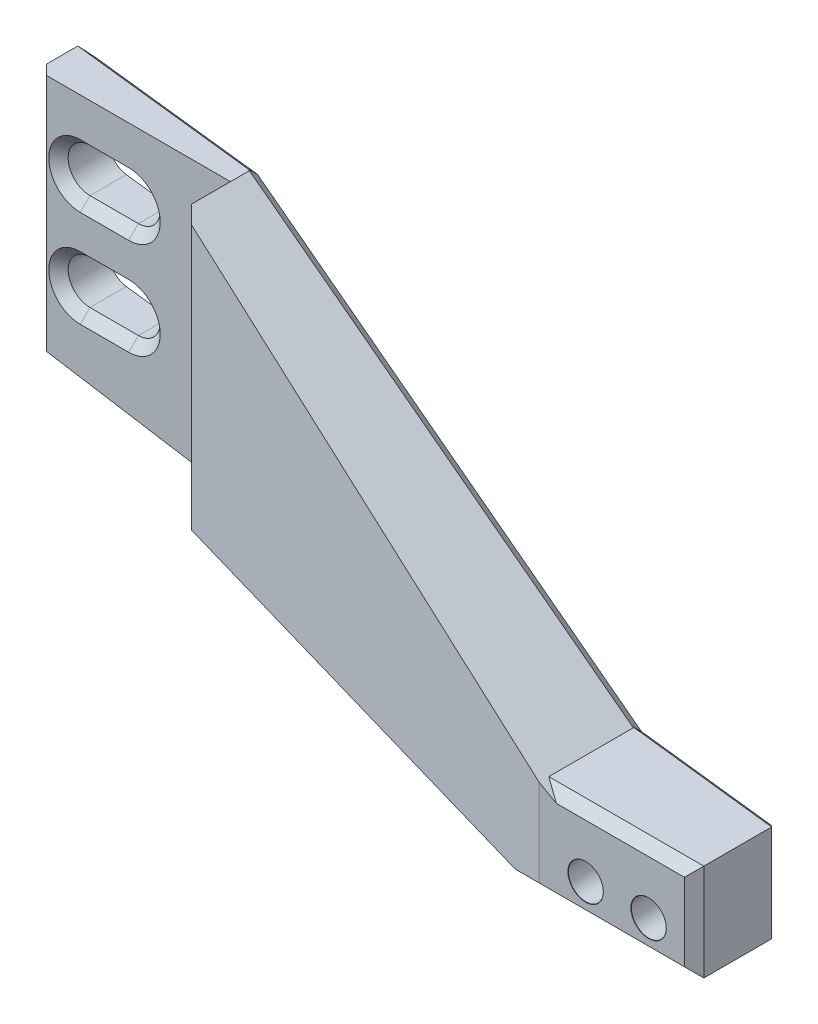
from build123d import *

# Parameters (mm, degrees)
BOSS_EXTRUDE1_DEPTH            = 18
CUT_EXTRUDE1_DEPTH             = 90.695930788
CHAMFER1_SIZE                  = 1
CHAMFER1_SIZE_2                = 1.13269448
CHAMFER1_SIZE_3                = 1.059024281
CHAMFER1_SIZE_4                = 0.982660718
CHAMFER1_SIZE_5                = 0.90514425
CHAMFER1_SIZE_6                = 1.228376825
M3_CLEARANCE_HOLE1_D           = 3.6
M3_CLEARANCE_HOLE1_DEPTH       = 4.418450886
M3_CLEARANCE_HOLE1_CSINK_D     = 3.65
M3_CLEARANCE_HOLE1_CSINK_ANGLE = 90
M3_CLEARANCE_HOLE1_TIP         = 1.081549114


with BuildPart() as part:
    # Sketch1 → Boss-Extrude1 (new body)
    with BuildSketch(Plane.XY):
        Polygon((0, 0), (0, 24.5), (64.6, 35), (80.6, 35), (80.6, 25), (64.6, 25), (20, 0), align=None)
        with BuildLine():
            Line((4.5, 19.5), (9.5, 19.5))
            ThreePointArc((9.5, 19.5), (11.75, 17.25), (9.5, 15))
            Line((9.5, 15), (4.5, 15))
            ThreePointArc((4.5, 15), (2.25, 17.25), (4.5, 19.5))
        make_face(mode=Mode.SUBTRACT)
        with BuildLine():
            Line((4.5, 9.5), (9.5, 9.5))
            ThreePointArc((9.5, 9.5), (11.75, 7.25), (9.5, 5))
            Line((9.5, 5), (4.5, 5))
            ThreePointArc((4.5, 5), (2.25, 7.25), (4.5, 9.5))
        make_face(mode=Mode.SUBTRACT)
    extrude(amount=BOSS_EXTRUDE1_DEPTH)

    # Sketch2 → Cut-Extrude1 (cut, through all)
    with BuildSketch(Plane.XZ):
        Polygon((0, 5.251895463), (20, 5.251895463), (20, 10.251895463), (64.6, 18), (0, 18), align=None)
        Polygon((0, 0), (80.6, 9), (80.6, 0), align=None)
    extrude(amount=-CUT_EXTRUDE1_DEPTH, mode=Mode.SUBTRACT)

    # Chamfer1
    # the kernel refuses this chamfer: 1.228376825, 1.13269448, 1.059024281, 1, 0.982660718, 0.90514425 mm, written as the material it takes off along each edge
    with BuildSketch(Plane(origin=(83.171682988, 25, 18), x_dir=(0, 0, -1), z_dir=(-1, 0, 0))) as chamfer1_piece_1_section:
        Polygon((CHAMFER1_SIZE, 0), (0, -CHAMFER1_SIZE), (0, 0), align=None)
    chamfer1_piece_1 = extrude(amount=26.286731952, mode=Mode.PRIVATE)
    chamfer1_piece_1 = split(chamfer1_piece_1, bisect_by=Plane(origin=(78.731517938, 32.921254449, 18), z_dir=(0.4889606682714293, -0.87230583219623, 0)), keep=Keep.TOP, mode=Mode.PRIVATE)
    add(chamfer1_piece_1, mode=Mode.SUBTRACT)
    with BuildSketch(Plane(origin=(80.6, 37.571682988, 18), x_dir=(0, 0, -1), z_dir=(0, -1, 0))) as chamfer1_piece_2:
        Polygon((CHAMFER1_SIZE, 0), (0, -CHAMFER1_SIZE), (0, 0), align=None)
    extrude(amount=15.143365976, mode=Mode.SUBTRACT)
    with BuildSketch(Plane(origin=(56.884951036, 35, 18), x_dir=(0, 0, -1), z_dir=(1, 0, 0))) as chamfer1_piece_3:
        Polygon((CHAMFER1_SIZE, 0), (0, -CHAMFER1_SIZE), (0, 0), align=None)
    extrude(amount=26.286731952, mode=Mode.SUBTRACT)
    with BuildSketch(Plane(origin=(9.5, 9.5, 5.251895463), x_dir=(0, 1, 0), z_dir=(-1, 0, 0)), Plane(origin=(4.5, 15, 5.251895463), x_dir=(0, -1, 0), z_dir=(1, 0, 0)), Plane(origin=(9.5, 19.5, 5.251895463), x_dir=(0, 1, 0), z_dir=(-1, 0, 0)), Plane(origin=(4.5, 5, 5.251895463), x_dir=(0, -1, 0), z_dir=(1, 0, 0))) as chamfer1_piece_4:
        Polygon((CHAMFER1_SIZE, 0), (0, CHAMFER1_SIZE), (0, 0), align=None)
    extrude(amount=5, mode=Mode.SUBTRACT)
    with BuildSketch(Plane(origin=(0, -2.571682988, 5.251895463), x_dir=(0, 0, -1), z_dir=(0, 1, 0))) as chamfer1_piece_5:
        Polygon((CHAMFER1_SIZE, 0), (0, -CHAMFER1_SIZE), (0, 0), align=None)
    extrude(amount=29.643365976, mode=Mode.SUBTRACT)
    with BuildSketch(Plane(origin=(4.5, 17.25, 5.251895463), x_dir=(0, -1, 0), z_dir=(1, 0, 0))) as chamfer1_piece_6:
        Polygon((2.25 + CHAMFER1_SIZE, 0), (2.25, CHAMFER1_SIZE), (2.25, 0), align=None)
    revolve(axis=Axis((4.5, 17.25, 5.251895463), (0, 0, -1)), revolution_arc=180, mode=Mode.SUBTRACT)
    with BuildSketch(Plane(origin=(9.5, 17.25, 5.251895463), x_dir=(0, 1, 0), z_dir=(-1, 0, 0))) as chamfer1_piece_7:
        Polygon((2.25 + CHAMFER1_SIZE, 0), (2.25, CHAMFER1_SIZE), (2.25, 0), align=None)
    revolve(axis=Axis((9.5, 17.25, 5.251895463), (0, 0, -1)), revolution_arc=180, mode=Mode.SUBTRACT)
    with BuildSketch(Plane(origin=(4.5, 7.25, 5.251895463), x_dir=(0, -1, 0), z_dir=(1, 0, 0))) as chamfer1_piece_8:
        Polygon((2.25 + CHAMFER1_SIZE, 0), (2.25, CHAMFER1_SIZE), (2.25, 0), align=None)
    revolve(axis=Axis((4.5, 7.25, 5.251895463), (0, 0, -1)), revolution_arc=180, mode=Mode.SUBTRACT)
    with BuildSketch(Plane(origin=(9.5, 7.25, 5.251895463), x_dir=(0, 1, 0), z_dir=(-1, 0, 0))) as chamfer1_piece_9:
        Polygon((2.25 + CHAMFER1_SIZE, 0), (2.25, CHAMFER1_SIZE), (2.25, 0), align=None)
    revolve(axis=Axis((9.5, 7.25, 5.251895463), (0, 0, -1)), revolution_arc=180, mode=Mode.SUBTRACT)
    with BuildSketch(Plane(origin=(80.6, 22.078920721, 9), x_dir=(-0.9938234393712555, 0, -0.11097284062458136), z_dir=(0, 1, 0))) as chamfer1_piece_10:
        Polygon((CHAMFER1_SIZE_2, 0), (-CHAMFER1_SIZE * 0.110972840625, CHAMFER1_SIZE * 0.993823439371), (0, 0), align=None)
    extrude(amount=15.842158559, mode=Mode.SUBTRACT)
    with BuildSketch(Plane(origin=(17.632153336, -1.327268309, 1.968850869), x_dir=(-0.48365166299246226, 0.873592837550041, -0.05400576882050032), z_dir=(0.8681970384240761, 0.48665753274892154, 0.09694507873221696))) as chamfer1_piece_11_section:
        Polygon((CHAMFER1_SIZE, 0), (-CHAMFER1_SIZE_3 * 0.0542613542965, CHAMFER1_SIZE_3 * 0.998526767225), (0, 0), align=None)
    chamfer1_piece_11 = extrude(amount=56.825456831, mode=Mode.PRIVATE)
    chamfer1_piece_11 = split(chamfer1_piece_11, bisect_by=Plane(origin=(17.632153336, 25, 1.968850869), z_dir=(0, -1, 0)), keep=Keep.TOP, mode=Mode.PRIVATE)
    add(chamfer1_piece_11, mode=Mode.SUBTRACT)
    with BuildSketch(Plane(origin=(72.169278028, 36.230300608, 8.058604246), x_dir=(0.15848267298847146, -0.987203157180204, 0.017696576388291016), z_dir=(-0.9811056370269924, -0.15946763450129123, -0.10955273862584283))) as chamfer1_piece_12:
        Polygon((CHAMFER1_SIZE, 0), (CHAMFER1_SIZE_4 * 0.0178037373512, CHAMFER1_SIZE_4 * 0.999841500402), (0, 0), align=None)
    extrude(amount=76.130813937, mode=Mode.SUBTRACT)
    with BuildSketch(Plane(origin=(0, -2.571682988, 0), x_dir=(0, 0, 1), z_dir=(0, 1, 0))) as chamfer1_piece_13:
        Polygon((CHAMFER1_SIZE_5, 0), (CHAMFER1_SIZE * 0.110972840625, CHAMFER1_SIZE * 0.993823439371), (0, 0), align=None)
    extrude(amount=29.643365976, mode=Mode.SUBTRACT)
    with BuildSketch(Plane(origin=(20, -3.172174758, 10.251895463), x_dir=(0.9852431265776485, 0, 0.17116068921192124), z_dir=(0, 1, 0))) as chamfer1_piece_14:
        Polygon((CHAMFER1_SIZE_6, 0), (-CHAMFER1_SIZE * 0.171160689212, CHAMFER1_SIZE * 0.985243126578), (0, 0), align=None)
    extrude(amount=34.095123509, mode=Mode.SUBTRACT)
    # the kernel refuses this chamfer: 1.228376825, 1.13269448, 1.059024281, 1, 0.982660718, 0.90514425 mm, written as the material it takes off along each edge
    with BuildSketch(Plane(origin=(-1.561975393, 0, -0.174414126), x_dir=(-0.11097284062458186, 0, 0.9938234393712553), z_dir=(0.9938234393712554, 0, 0.11097284062458188))) as chamfer1_2_piece_1:
        Polygon((CHAMFER1_SIZE, 0), (0, -CHAMFER1_SIZE), (0, 0), align=None)
    extrude(amount=22.212831842, mode=Mode.SUBTRACT)
    with BuildSketch(Plane(origin=(82.030100508, 25, 9.159688642), x_dir=(-0.11097284062458178, -3.5527136788004942e-15, 0.9938234393712553), z_dir=(-0.9938234393712554, 0, -0.11097284062458179))) as chamfer1_2_piece_2_section:
        Polygon((CHAMFER1_SIZE, 0), (0, CHAMFER1_SIZE), (0, 0), align=None)
    chamfer1_2_piece_2 = extrude(amount=22.164943744, mode=Mode.PRIVATE)
    chamfer1_2_piece_2 = split(chamfer1_2_piece_2, bisect_by=Plane(origin=(79.195166365, 29.16494468, 13.640367099), z_dir=(0.42046301876729836, -0.6177234194276358, -0.6645514479253808)), keep=Keep.TOP, mode=Mode.PRIVATE)
    add(chamfer1_2_piece_2, mode=Mode.SUBTRACT)
    with BuildSketch(Plane(origin=(82.030100508, 35, 9.159688642), x_dir=(-0.11097284062458186, -7.105427357601003e-15, 0.9938234393712553), z_dir=(-0.9938234393712554, 0, -0.11097284062458188))) as chamfer1_2_piece_3:
        Polygon((CHAMFER1_SIZE, 0), (0, -CHAMFER1_SIZE), (0, 0), align=None)
    extrude(amount=18.982611683, mode=Mode.SUBTRACT)

    # M3 Clearance Hole1
    with Locations(Plane.XY.offset(18)):
        with Locations((69.4, 31.5), (75.9, 31.5)):
            CounterSinkHole(M3_CLEARANCE_HOLE1_D / 2, M3_CLEARANCE_HOLE1_CSINK_D / 2, depth=M3_CLEARANCE_HOLE1_DEPTH, counter_sink_angle=M3_CLEARANCE_HOLE1_CSINK_ANGLE)
            with Locations((0, 0, -(M3_CLEARANCE_HOLE1_DEPTH + M3_CLEARANCE_HOLE1_TIP / 2))):  # 118° drill point
                Cone(0, M3_CLEARANCE_HOLE1_D / 2, M3_CLEARANCE_HOLE1_TIP, mode=Mode.SUBTRACT)


with BuildPart() as body_2:
    # Mirror2: mirrored copy
    add(part.part.mirror(Plane(origin=(20, 0, 18), x_dir=(0, 0, 1), z_dir=(0, 1, 0))))


solid = body_2.part
